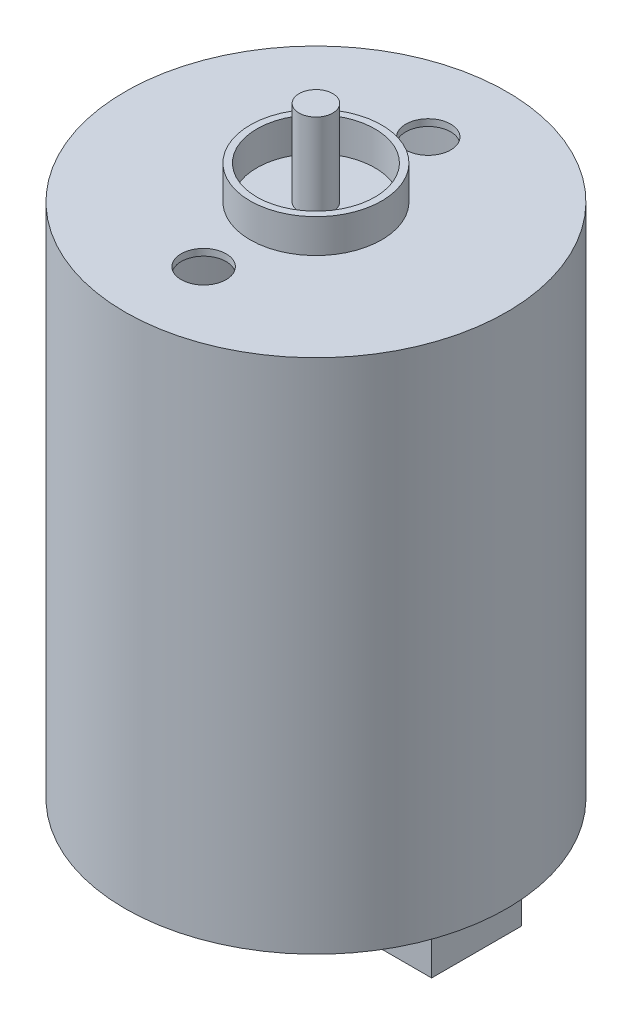
from build123d import *

# Parameters (mm, degrees)
SKETCH1_R           = 8.5
BOSS_EXTRUDE1_DEPTH = 23
SHELL3_T            = -0.3
SKETCH2_R           = 8.2
BOSS_EXTRUDE2_DEPTH = 0.3
SKETCH3_R           = 1.15
BOSS_EXTRUDE3_DEPTH = 1.5
SKETCH4_R           = 2.929639603
SKETCH4_R_2         = 2.629639603
BOSS_EXTRUDE4_DEPTH = 1.5
SKETCH5_R           = 0.75
BOSS_EXTRUDE5_DEPTH = 3.8
CUT_EXTRUDE1_REACH  = 28.842
SKETCH7_R           = 1
SKETCH8_W           = 2.3
SKETCH8_H           = 4
BOSS_EXTRUDE7_DEPTH = 2.85


with BuildPart() as part:
    # Sketch1 → Boss-Extrude1 (new body)
    with BuildSketch(Plane(origin=(0, 0, 0), x_dir=(1, 0, 0), z_dir=(0, 1, 0))):
        Circle(SKETCH1_R)
    extrude(amount=BOSS_EXTRUDE1_DEPTH)

    # Shell3
    shell3_openings = [part.faces().sort_by_distance(p)[0] for p in [
        (0, 0, 0),
    ]]
    offset(amount=SHELL3_T, openings=shell3_openings, kind=Kind.INTERSECTION)

    # Sketch2 → Boss-Extrude2 (add)
    with BuildSketch(Plane(origin=(0, 0.5, 0), x_dir=(-1, 0, 0), z_dir=(0, -1, 0))):
        Circle(SKETCH2_R)
    extrude(amount=-BOSS_EXTRUDE2_DEPTH)

    # Sketch3 → Boss-Extrude3 (add)
    with BuildSketch(Plane.XZ.offset(-0.5)):
        Circle(SKETCH3_R)
    extrude(amount=BOSS_EXTRUDE3_DEPTH)

    # Sketch4 → Boss-Extrude4 (add)
    with BuildSketch(Plane(origin=(0, 23, 0), x_dir=(1, 0, 0), z_dir=(0, 1, 0))):
        Circle(SKETCH4_R)
        Circle(SKETCH4_R_2, mode=Mode.SUBTRACT)
    extrude(amount=BOSS_EXTRUDE4_DEPTH)

    # Sketch5 → Boss-Extrude5 (add)
    with BuildSketch(Plane(origin=(0, 23, 0), x_dir=(1, 0, 0), z_dir=(0, 1, 0))):
        Circle(SKETCH5_R)
    extrude(amount=BOSS_EXTRUDE5_DEPTH)

    # Sketch7 → Cut-Extrude1 (cut, up to next)
    with BuildSketch(Plane(origin=(0, 23, 0), x_dir=(1, 0, 0), z_dir=(0, 1, 0)), mode=Mode.PRIVATE) as cut_extrude1_sk1:
        with Locations((0, 5)):
            Circle(SKETCH7_R)
    cut_extrude1_tool1 = extrude(cut_extrude1_sk1.sketch, amount=-CUT_EXTRUDE1_REACH, mode=Mode.PRIVATE) & part.part
    # Sketch7 → Cut-Extrude1 (cut, up to next)
    with BuildSketch(Plane(origin=(0, 23, 0), x_dir=(1, 0, 0), z_dir=(0, 1, 0)), mode=Mode.PRIVATE) as cut_extrude1_sk2:
        with Locations((0, -5)):
            Circle(SKETCH7_R)
    cut_extrude1_tool2 = extrude(cut_extrude1_sk2.sketch, amount=-CUT_EXTRUDE1_REACH, mode=Mode.PRIVATE) & part.part
    add(cut_extrude1_tool1.solids().sort_by_distance((0, 23, -5))[0], mode=Mode.SUBTRACT)
    add(cut_extrude1_tool2.solids().sort_by_distance((0, 23, 5))[0], mode=Mode.SUBTRACT)

    # Sketch8 → Boss-Extrude7 (add)
    with BuildSketch(Plane.XZ.offset(-0.5)):
        with Locations((-6, 0)):
            Rectangle(SKETCH8_W, SKETCH8_H)
        with Locations((6, 0)):
            Rectangle(SKETCH8_W, SKETCH8_H)
    extrude(amount=BOSS_EXTRUDE7_DEPTH)


solid = part.part
